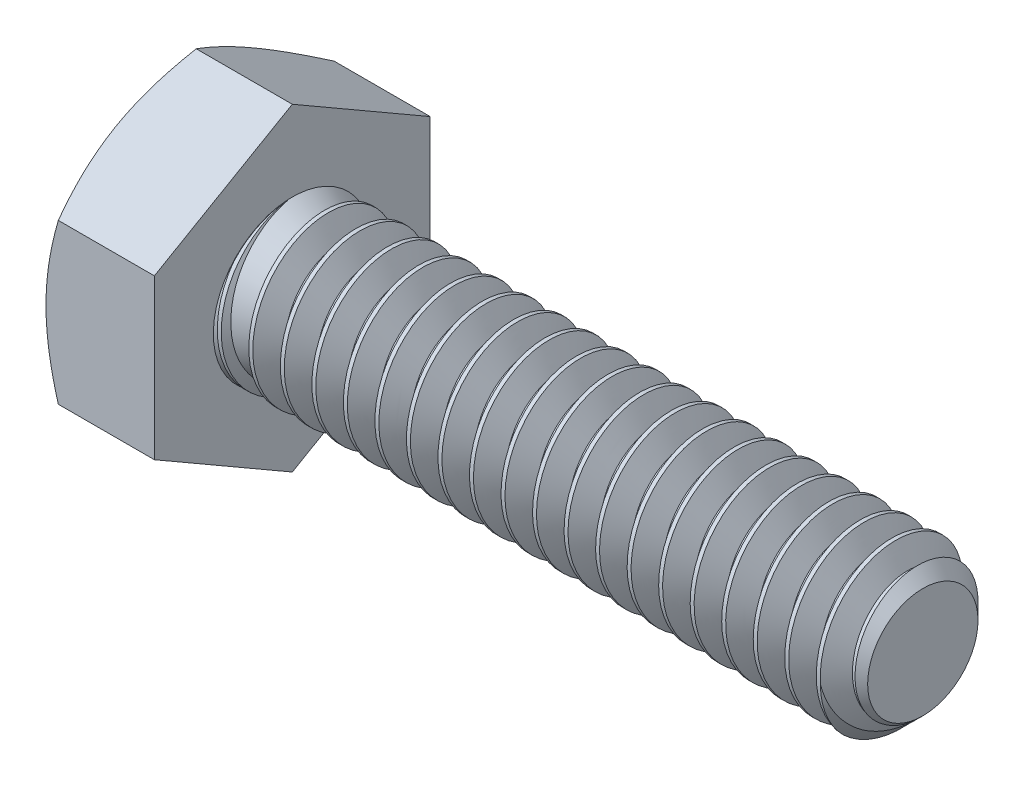
from build123d import *

# Parameters (mm, degrees)
SKETCH5_R           = 3.175
BOSS_EXTRUDE3_DEPTH = 25.4
CHAMFER1_SIZE       = 0.9525
BOSS_EXTRUDE4_DEPTH = 4.365625
SKETCH8_OUTSIDE_W   = 130.65
SKETCH8_OUTSIDE_H   = 132.37
SKETCH8_OUTSIDE_R   = 5.55625
CUT_EXTRUDE3_DEPTH  = 31.952009592
CUT_EXTRUDE3_DRAFT  = -60
CUT_EXTRUDE4_DEPTH  = 0.254
CIRPATTERN1_COUNT   = 6
CUT_SWEEP1_PITCH    = 1.27


with BuildPart() as part:
    # Sketch5 → Boss-Extrude3 (new body)
    with BuildSketch(Plane(origin=(14.8828125, 0, 0), x_dir=(0, 0, -1), z_dir=(1, 0, 0))):
        Circle(SKETCH5_R)
    extrude(amount=-BOSS_EXTRUDE3_DEPTH)

    # Chamfer1
    chamfer1_edges = [part.edges().sort_by_distance(p)[0] for p in [
        (14.8828125, 0, 3.175),
    ]]
    chamfer(chamfer1_edges, length=CHAMFER1_SIZE)

    # Cut-Sweep1: the profile of Sketch10 profile screwed along a right-hand helix of 21 turns, 8 arcs to a turn; built about Z, then put on its axis
    cut_sweep1_z = Axis((0, 0, 0), (0, 0, 1))
    cut_sweep1_corners = [(3.1753, 0, 0.000173205), (2.350110803, 0, -0.47625), (2.350110803, 0, -0.635), (3.1753, 0, -1.111423205)]
    with BuildLine(mode=Mode.PRIVATE) as cut_sweep1_profile:
        Line(cut_sweep1_corners[0], cut_sweep1_corners[1])
        Line(cut_sweep1_corners[1], cut_sweep1_corners[2])
        Line(cut_sweep1_corners[2], cut_sweep1_corners[3])
        Line(cut_sweep1_corners[3], cut_sweep1_corners[0])
    cut_sweep1_cap = Face(cut_sweep1_profile.wire())
    cut_sweep1_turn_angles = [0, 22.5, 45, 67.5, 90, 112.5, 135, 157.5, 180, 202.5, 225, 247.5, 270, 292.5, 315, 337.5, 360]
    cut_sweep1_turn_weights = [1, 0.9238795325112867, 1, 0.9238795325112867, 1, 0.9238795325112867, 1, 0.9238795325112867, 1, 0.9238795325112867, 1, 0.9238795325112867, 1, 0.9238795325112867, 1, 0.9238795325112867, 1]
    cut_sweep1_turn_rails = [Edge.make_bspline([Vector(p[0], p[1], 0).rotate(cut_sweep1_z, cut_sweep1_turn_angles[k]) / cut_sweep1_turn_weights[k] + Vector(0, 0, p[2] + CUT_SWEEP1_PITCH * cut_sweep1_turn_angles[k] / 360) for k in range(17)], [0, 0, 0, 1, 1, 2, 2, 3, 3, 4, 4, 5, 5, 6, 6, 7, 7, 8, 8, 8], 2, cut_sweep1_turn_weights) for p in cut_sweep1_corners]
    cut_sweep1_turn_sides = [Face.make_surface_from_curves(cut_sweep1_turn_rails[p[0]], cut_sweep1_turn_rails[p[1]]) for p in [(0, 1), (1, 2), (2, 3), (3, 0)]]
    cut_sweep1 = Plane(origin=(14.8828125, 0, 0), x_dir=(0, 1, 0), z_dir=(-1, 0, 0)) * Solid(Shell([*[p.moved(Location((0, 0, CUT_SWEEP1_PITCH * i))) for i in range(21) for p in cut_sweep1_turn_sides], cut_sweep1_cap, cut_sweep1_cap.rotate(cut_sweep1_z, 7560).moved(Location((0, 0, CUT_SWEEP1_PITCH * 7560 / 360)))]))
    add(cut_sweep1, mode=Mode.SUBTRACT)



with BuildPart() as body_2:
    # Sketch6 → Boss-Extrude4 (new body)
    with BuildSketch(Plane.ZY.offset(10.5171875)):
        Polygon((5.55625, 3.207902433), (0, 6.415804866), (-5.55625, 3.207902433), (-5.55625, -3.207902433), (0, -6.415804866), (5.55625, -3.207902433), align=None)
    extrude(amount=BOSS_EXTRUDE4_DEPTH)


with BuildPart() as cut_extrude3_tool:
    # Sketch8 outside → Cut-Extrude3 (with draft: the straight prism first)
    with BuildSketch(Plane.ZY.offset(14.8828125)):
        Rectangle(SKETCH8_OUTSIDE_W, SKETCH8_OUTSIDE_H)
        Circle(SKETCH8_OUTSIDE_R, mode=Mode.SUBTRACT)
    extrude(amount=-CUT_EXTRUDE3_DEPTH)
    # Cut-Extrude3: the draft: its side faces are tilted about the plane it starts from
    cut_extrude3_sides = [cut_extrude3_tool.faces().sort_by_distance(p)[0] for p in [
        (1.093192296, -66.185, 0),
        (1.093192296, 0, 65.325),
        (1.093192296, 66.185, 0),
        (1.093192296, 0, -65.325),
        (1.093192296, 0, -5.55625),
    ]]
    draft(cut_extrude3_sides, Plane.ZY.offset(14.8828125), CUT_EXTRUDE3_DRAFT)


with BuildPart() as body_2_1:
    add(body_2.part)

    # Cut-Extrude3: cut by cut_extrude3_tool
    add(cut_extrude3_tool.part, mode=Mode.SUBTRACT)

    # Sketch12 → Cut-Extrude4 (cut)
    with BuildSketch(Plane.ZY.offset(14.8828125)):
        with BuildLine():
            Line((0.1666875, 4.2783125), (0.1666875, 2.3891875))
            ThreePointArc((0.1666875, 2.3891875), (0, 2.2225), (-0.1666875, 2.3891875))
            Line((-0.1666875, 2.3891875), (-0.1666875, 4.2783125))
            ThreePointArc((-0.1666875, 4.2783125), (0, 4.445), (0.1666875, 4.2783125))
        make_face()
    cut_extrude4 = extrude(amount=-CUT_EXTRUDE4_DEPTH, mode=Mode.SUBTRACT)

    # CirPattern1: Cut-Extrude4 ×6 about axis
    cirpattern1_axis = Axis((0, 0, 0), (1, 0, 0))
    for i in range(1, CIRPATTERN1_COUNT):
        add(cut_extrude4.rotate(cirpattern1_axis, i * 360 / CIRPATTERN1_COUNT), mode=Mode.SUBTRACT)


with BuildPart() as part_1:
    add(part.part)

    add(body_2_1.part)  # Revolve7 merges body 2
    # Sketch13 → Revolve7 (revolve)
    with BuildSketch(Plane.XY, mode=Mode.PRIVATE) as revolve7_sk:
        Polygon((-10.7711875, 0), (-5.007147634, 0), (-10.5171875, 3.181223), (-10.7711875, 3.181223), align=None)
    revolve(revolve7_sk.sketch.rotate(Axis((-10.7711875, 0, 0), (1, 0, 0)), 180), axis=Axis((-10.7711875, 0, 0), (1, 0, 0)))


solid = part_1.part
